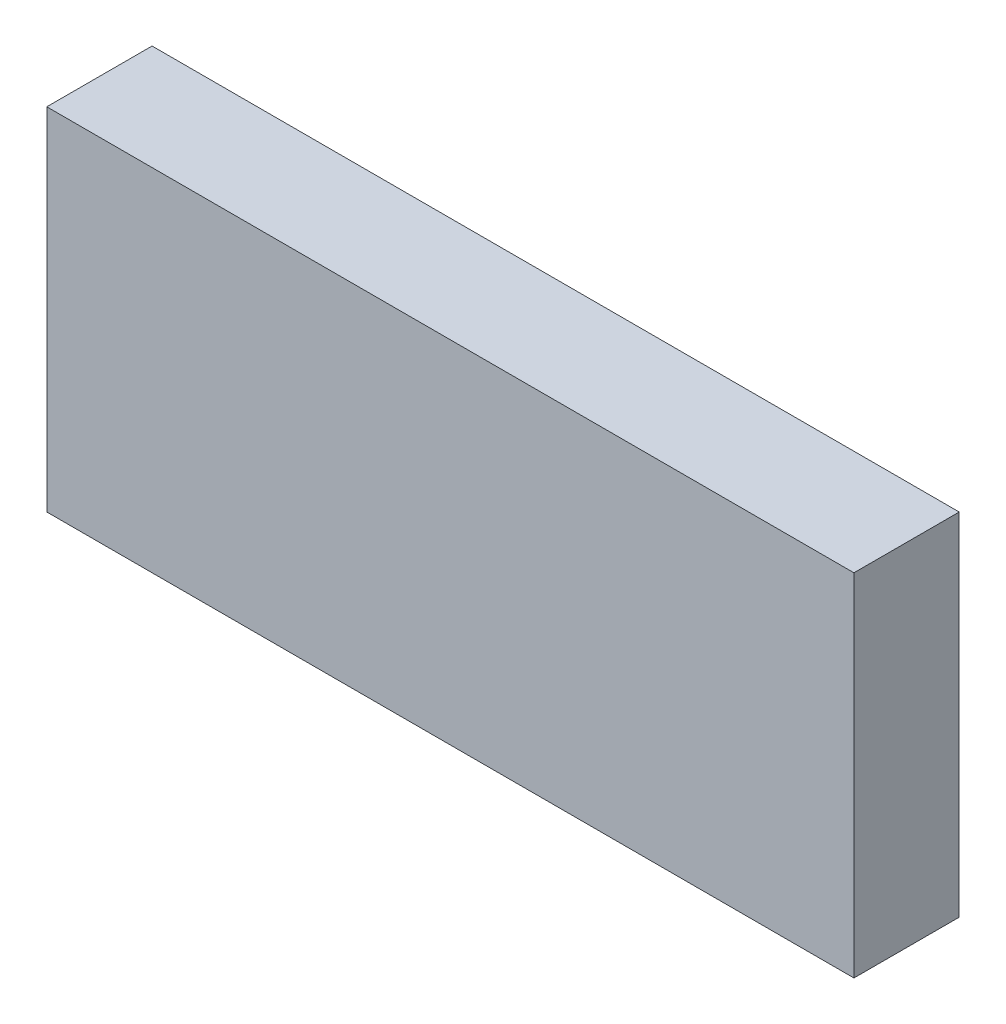
from build123d import *

# Parameters (mm, degrees)
SKETCH2_W           = 46
SKETCH2_H           = 20
BOSS_EXTRUDE1_DEPTH = 6


with BuildPart() as part:
    # Sketch2 → Boss-Extrude1 (new body)
    with BuildSketch(Plane.XY):
        Rectangle(SKETCH2_W, SKETCH2_H)
    extrude(amount=BOSS_EXTRUDE1_DEPTH)


solid = part.part
